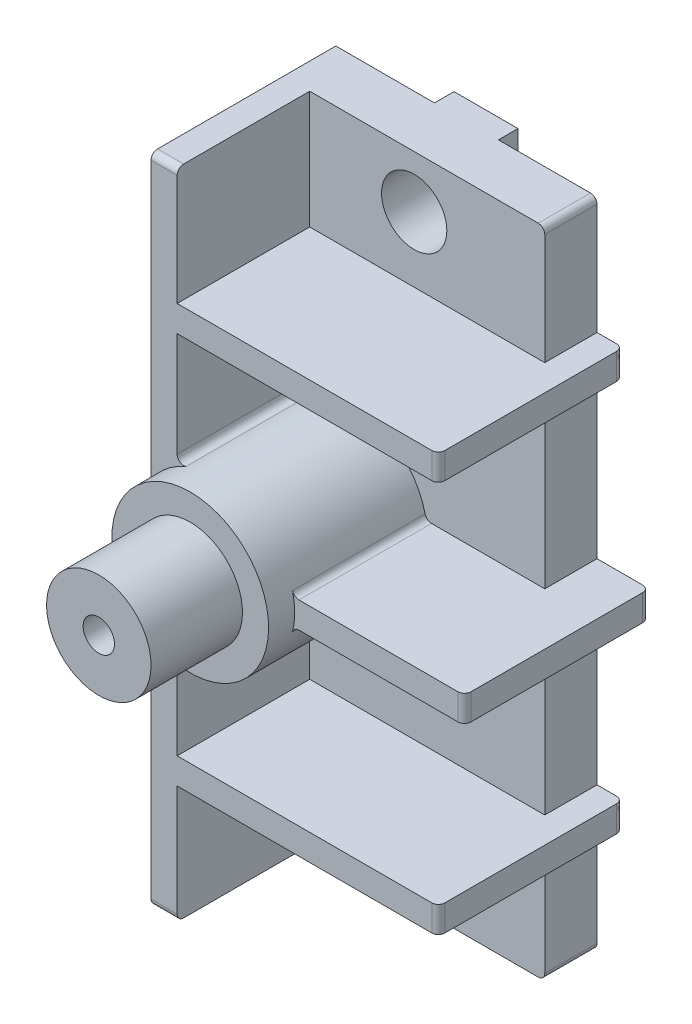
from build123d import *

# Parameters (mm, degrees)
BOSS_EXTRU_1_DEPTH      = 25
ESQUISSE5_W             = 10.15
ESQUISSE5_H             = 50
BOSS_EXTRU_2_DEPTH      = 2
BOSS_EXTRU_3_REACH      = 35.09
ESQUISSE6_W             = 22
ESQUISSE6_H             = 2
ESQUISSE6_W_2           = 13.083920217
ESQUISSE7_R             = 2.5
ENL_V_MAT_EXTRU_1_DEPTH = 37.779376014
CONG_1_R                = 0.5


with BuildPart() as part:
    # Esquisse1 → Boss.-Extru.1 (new, symmetric)
    with BuildSketch(Plane(origin=(0, 0, 0), x_dir=(1, 0, 0), z_dir=(0, 1, 0))):
        Polygon((7.45, 0), (15, 0), (15, -4), (-5, -4), (-5, 0), (2.55, 0), (2.55, 1.5), (7.45, 1.5), align=None)
    extrude(amount=BOSS_EXTRU_1_DEPTH, both=True)

    # Esquisse3 → Révolution1 (revolve)
    with BuildSketch(Plane(origin=(0, 0, 0), x_dir=(0, 0, -1), z_dir=(1, 0, 0))):
        Polygon((0, 6), (-16.15, 6), (-16.15, 4), (-23.15, 4), (-23.15, 1.2), (0, 1.2), align=None)
    revolve(axis=Axis((0, 0, 0), (0, 0, 1)))

    # Esquisse5 → Boss.-Extru.2 (add)
    with BuildSketch(Plane.ZY.offset(5)):
        with Locations((9.075, 0)):
            Rectangle(ESQUISSE5_W, ESQUISSE5_H)
    extrude(amount=-BOSS_EXTRU_2_DEPTH)

    # Boss.-Extru.3: up to this face of the body (flat: up to its plane)
    boss_extru_3_end = Plane(part.part.faces().sort_by_distance((11.225, 0, 0))[0])
    # Esquisse6 → Boss.-Extru.3 (add, up to the picked face)
    with BuildSketch(Plane.XY.offset(14.15), mode=Mode.PRIVATE) as boss_extru_3_sk1:
        with Locations((6, 15)):
            Rectangle(ESQUISSE6_W, ESQUISSE6_H)
    boss_extru_3_tool1 = split(extrude(boss_extru_3_sk1.sketch, amount=-BOSS_EXTRU_3_REACH, mode=Mode.PRIVATE), bisect_by=boss_extru_3_end, keep=Keep.BOTH, mode=Mode.PRIVATE)
    # Esquisse6 → Boss.-Extru.3 (add, up to the picked face)
    with BuildSketch(Plane.XY.offset(14.15), mode=Mode.PRIVATE) as boss_extru_3_sk2:
        with Locations((6, -15)):
            Rectangle(ESQUISSE6_W, ESQUISSE6_H)
    boss_extru_3_tool2 = split(extrude(boss_extru_3_sk2.sketch, amount=-BOSS_EXTRU_3_REACH, mode=Mode.PRIVATE), bisect_by=boss_extru_3_end, keep=Keep.BOTH, mode=Mode.PRIVATE)
    # Esquisse6 → Boss.-Extru.3 (add, up to the picked face)
    with BuildSketch(Plane.XY.offset(14.15), mode=Mode.PRIVATE) as boss_extru_3_sk3:
        with Locations((12.458039892, 0)):
            Rectangle(ESQUISSE6_W_2, ESQUISSE6_H)
    boss_extru_3_tool3 = split(extrude(boss_extru_3_sk3.sketch, amount=-BOSS_EXTRU_3_REACH, mode=Mode.PRIVATE), bisect_by=boss_extru_3_end, keep=Keep.BOTH, mode=Mode.PRIVATE)
    add(boss_extru_3_tool1.solids().sort_by(Axis((6, 15, 14.15), (0, 0, -1)))[0])
    add(boss_extru_3_tool2.solids().sort_by(Axis((6, -15, 14.15), (0, 0, -1)))[0])
    add(boss_extru_3_tool3.solids().sort_by(Axis((12.45804, 0, 14.15), (0, 0, -1)))[0])

    # Esquisse7 → Enlèv. mat.-Extru.1 (cut, through all)
    with BuildSketch(Plane.XY.offset(4)):
        with Locations((5, 21)):
            Circle(ESQUISSE7_R)
        with Locations(Location((5, -21, 0), (0, 0, 348.521659045))):
            Circle(ESQUISSE7_R)
    extrude(amount=-ENL_V_MAT_EXTRU_1_DEPTH, mode=Mode.SUBTRACT)

    # Congé1
    # the kernel refuses this fillet: 0.5 mm, written as the material it adds along each edge
    with BuildSketch(Plane(origin=(5.916079783, 1, 14.15), x_dir=(1, 0, 0), z_dir=(0, 0, -1))) as cong_1_piece_1:
        with BuildLine():
            CenterArc((0.408475537, -0.5), CONG_1_R, 90, 76.657636203)
            ThreePointArc((-0.078028718, -0.384615385), (-0.035868882, -0.19294583), (0, 0))
            Line((0, 0), (0.408475537, 0))
        make_face()
    extrude(amount=11.171188843)
    with BuildSketch(Plane(origin=(5.916079783, -1, 14.15), x_dir=(1, 0, 0), z_dir=(0, 0, -1))) as cong_1_piece_2:
        with BuildLine():
            CenterArc((0.408475537, 0.5), CONG_1_R, 193.342363797, 76.657636203)
            ThreePointArc((-0.078028718, 0.384615385), (-0.035868882, 0.19294583), (0, 0))
            Line((0, 0), (0.408475537, 0))
        make_face()
    extrude(amount=11.171188843)
    with BuildSketch(Plane(origin=(-3, -5.196152423, 1.990381057), x_dir=(0.8964096085841841, -0.44322659401027603, 0), z_dir=(0, 0, 1))) as cong_1_piece_3:
        with BuildLine():
            CenterArc((0.804491428, -0.498963395), CONG_1_R, 93.690067526, 112.619864948)
            Line((0.356286624, -0.720576692), (0, 0))
            ThreePointArc((0, 0), (0.386155885, -0.012439259), (0.772311771, 0))
        make_face()
    extrude(amount=12.159618943)
    with BuildSketch(Plane(origin=(-3, 5.196152423, 1.990381057), x_dir=(0, 1, 0), z_dir=(0, 0, 1))) as cong_1_piece_4:
        with BuildLine():
            CenterArc((0.803847577, -0.5), CONG_1_R, 90, 112.619864948)
            ThreePointArc((0.342309116, -0.692307692), (0.182305229, -0.340640436), (0, 0))
            Line((0, 0), (0.803847577, 0))
        make_face()
    extrude(amount=12.159618943)
    # the kernel refuses this fillet: 0.5 mm, written as the material it takes off along each edge
    with BuildSketch(Plane(origin=(15, 25, -1.25), x_dir=(0, -1, 0), z_dir=(0, 0, 1)), Plane(origin=(15, -25, -1.25), x_dir=(-1, 0, 0), z_dir=(0, 0, 1))) as cong_1_2_piece_1:
        with BuildLine():
            CenterArc((CONG_1_R, -CONG_1_R), CONG_1_R, 90, 90)
            Line((0, -CONG_1_R), (0, 0))
            Line((0, 0), (CONG_1_R, 0))
        make_face()
    extrude(amount=6.5, mode=Mode.SUBTRACT)
    with BuildSketch(Plane(origin=(17, -17.25, 0), x_dir=(-1, 0, 0), z_dir=(0, 1, 0)), Plane(origin=(19, 2.25, 14.15), x_dir=(-1, 0, 0), z_dir=(0, -1, 0)), Plane(origin=(-6.25, 25, 14.15), x_dir=(0, -1, 0), z_dir=(1, 0, 0)), Plane(origin=(-6.25, -25, 14.15), x_dir=(0, 0, -1), z_dir=(1, 0, 0)), Plane(origin=(17, 17.25, 14.15), x_dir=(-1, 0, 0), z_dir=(0, -1, 0))) as cong_1_2_piece_2:
        with BuildLine():
            CenterArc((CONG_1_R, CONG_1_R), CONG_1_R, 180, 90)
            Line((0, CONG_1_R), (0, 0))
            Line((0, 0), (CONG_1_R, 0))
        make_face()
    extrude(amount=4.5, mode=Mode.SUBTRACT)
    with BuildSketch(Plane(origin=(17, -17.25, 14.15), x_dir=(-1, 0, 0), z_dir=(0, 1, 0)), Plane(origin=(19, 2.25, 0), x_dir=(-1, 0, 0), z_dir=(0, -1, 0)), Plane(origin=(17, 17.25, 0), x_dir=(-1, 0, 0), z_dir=(0, -1, 0))) as cong_1_2_piece_3:
        with BuildLine():
            CenterArc((CONG_1_R, -CONG_1_R), CONG_1_R, 90, 90)
            Line((0, -CONG_1_R), (0, 0))
            Line((0, 0), (CONG_1_R, 0))
        make_face()
    extrude(amount=4.5, mode=Mode.SUBTRACT)
    with BuildSketch(Plane(origin=(7.45, 20.502506281, -5.955772261), x_dir=(-0.5070626183882774, -0.8619092185568178, 0), z_dir=(0, 0, 1))) as cong_1_2_piece_4:
        with BuildLine():
            CenterArc((1.789719784, 0.472787611), CONG_1_R, 120.468369541, 130.541601874)
            Line((1.536188475, 0.90374222), (0, 0))
            ThreePointArc((0, 0), (0.813508993, 0.136061947), (1.627017986, 0))
        make_face()
    extrude(amount=5.955772261, mode=Mode.SUBTRACT)
    with BuildSketch(Plane(origin=(7.45, 21.497493719, -5.955772261), x_dir=(0, 1, 0), z_dir=(0, 0, 1)), Plane(origin=(2.55, 20.502506281, -5.955772261), x_dir=(0, -1, 0), z_dir=(0, 0, 1)), Plane(origin=(7.45, -20.502506281, -5.955772261), x_dir=(0, 1, 0), z_dir=(0, 0, 1)), Plane(origin=(2.55, -21.497493719, -5.955772261), x_dir=(0, -1, 0), z_dir=(0, 0, 1))) as cong_1_2_piece_5:
        with BuildLine():
            CenterArc((1.782308904, 0.5), CONG_1_R, 139.458398126, 130.541601874)
            ThreePointArc((1.402341801, 0.825), (0.770162827, 0.295226954), (0, 0))
            Line((0, 0), (1.782308904, 0))
        make_face()
    extrude(amount=5.955772261, mode=Mode.SUBTRACT)
    with BuildSketch(Plane(origin=(2.55, 21.497493719, -5.955772261), x_dir=(0, 1, 0), z_dir=(0, 0, 1)), Plane(origin=(2.55, -20.502506281, -5.955772261), x_dir=(0, 1, 0), z_dir=(0, 0, 1))) as cong_1_2_piece_6:
        with BuildLine():
            CenterArc((1.782308904, -0.5), CONG_1_R, 90, 130.541601874)
            ThreePointArc((1.402341801, -0.825), (0.770162827, -0.295226954), (0, 0))
            Line((0, 0), (1.782308904, 0))
        make_face()
    extrude(amount=5.955772261, mode=Mode.SUBTRACT)
    with BuildSketch(Plane(origin=(7.45, -21.497493719, 0), x_dir=(-0.507062618391788, -0.8619092185547524, 0), z_dir=(0, 0, -1))) as cong_1_2_piece_7:
        with BuildLine():
            CenterArc((1.789719784, -0.472787611), CONG_1_R, 108.990028586, 130.541601874)
            Line((1.536188475, -0.90374222), (0, 0))
            ThreePointArc((0, 0), (0.813508993, -0.136061947), (1.627017986, 0))
        make_face()
    extrude(amount=5.955772261, mode=Mode.SUBTRACT)


solid = part.part
